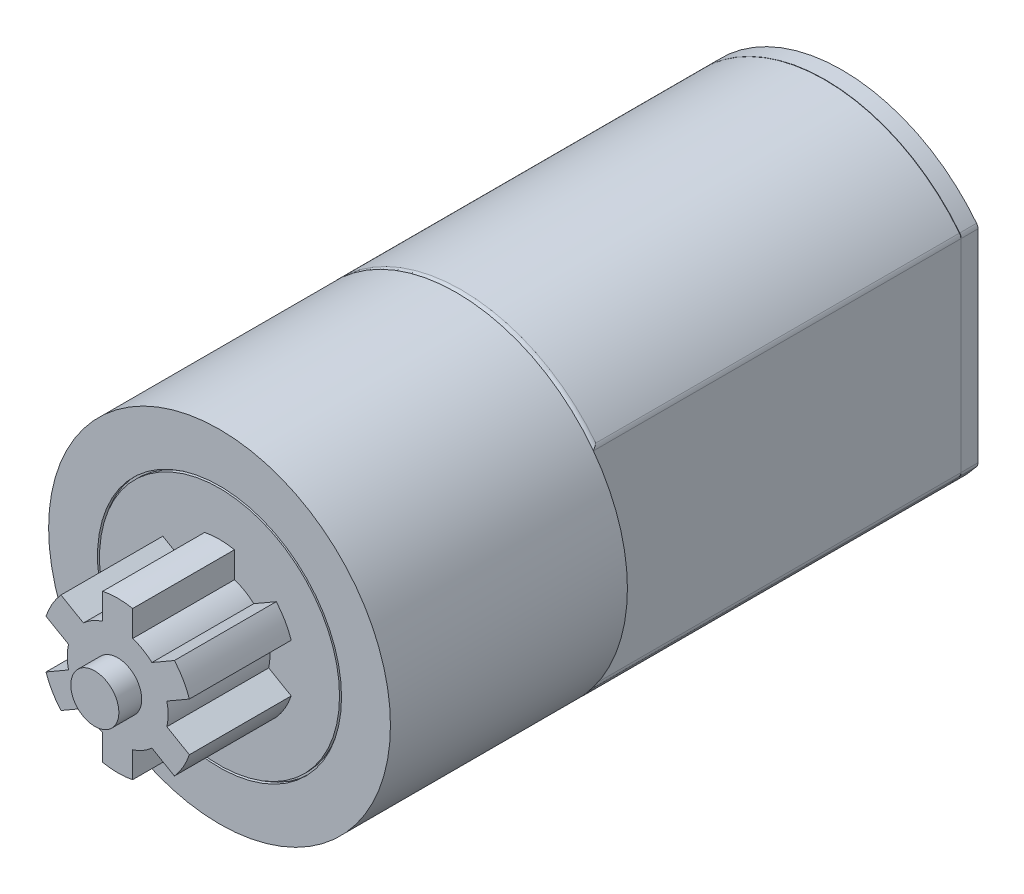
from build123d import *

# Parameters (mm, degrees)
SKETCH1_R           = 5.085
BOSS_EXTRUDE1_DEPTH = 23.23
SKETCH2_R           = 5.085
SKETCH2_R_2         = 2
CUT_EXTRUDE1_DEPTH  = 1
SKETCH4_R           = 0.8
CUT_EXTRUDE2_DEPTH  = 0.5
SKETCH5_W           = 3.99879876
SKETCH5_H           = 10.17
SKETCH5_W_2         = 3.491908776
CUT_EXTRUDE3_DEPTH  = 12.47
CUT_EXTRUDE4_START  = -3.71
SKETCH6_R           = 5.085
SKETCH6_R_2         = 2.25
CUT_EXTRUDE4_DEPTH  = 3.71
SKETCH7_R           = 3.63
SKETCH7_R_2         = 3.57
CUT_EXTRUDE5_DEPTH  = 0.1
CUT_EXTRUDE6_START  = -0.68
SKETCH8_R           = 2.25
SKETCH8_R_2         = 0.715
CUT_EXTRUDE6_DEPTH  = 0.68
CUT_EXTRUDE7_START  = -3.03
CUT_EXTRUDE7_DEPTH  = 3.03
SKETCH10_R          = 0.455
BOSS_EXTRUDE2_DEPTH = 0.68
CUT_EXTRUDE8_START  = 0.01
SKETCH11_R          = 5.085
SKETCH11_R_2        = 5.035
CUT_EXTRUDE8_DEPTH  = 0.01
FILLET3_R           = 0.2
CUT_EXTRUDE9_DEPTH  = 0.01


with BuildPart() as part:
    # Sketch1 → Boss-Extrude1 (new body)
    with BuildSketch(Plane.XY):
        Circle(SKETCH1_R)
    extrude(amount=BOSS_EXTRUDE1_DEPTH)

    # Sketch2 → Cut-Extrude1 (cut)
    with BuildSketch(Plane(origin=(0, 0, 0), x_dir=(-1, 0, 0), z_dir=(0, 0, -1))):
        Circle(SKETCH2_R)
        Circle(SKETCH2_R_2, mode=Mode.SUBTRACT)
    extrude(amount=-CUT_EXTRUDE1_DEPTH, mode=Mode.SUBTRACT)

    # Sketch4 → Cut-Extrude2 (cut)
    with BuildSketch(Plane(origin=(0, 0, 0), x_dir=(-1, 0, 0), z_dir=(0, 0, -1))):
        Circle(SKETCH4_R)
    extrude(amount=-CUT_EXTRUDE2_DEPTH, mode=Mode.SUBTRACT)

    # Sketch5 → Cut-Extrude3 (cut)
    with BuildSketch(Plane(origin=(0, 0, 0), x_dir=(-1, 0, 0), z_dir=(0, 0, -1))):
        with Locations((6.04439938, 0)):
            Rectangle(SKETCH5_W, SKETCH5_H)
        with Locations((-5.790954388, 0)):
            Rectangle(SKETCH5_W_2, SKETCH5_H)
    extrude(amount=-CUT_EXTRUDE3_DEPTH, mode=Mode.SUBTRACT)

    # Sketch6 → Cut-Extrude4 (cut)
    with BuildSketch(Plane.XY.offset(23.23).offset(CUT_EXTRUDE4_START)):
        with Locations(Location((0, 0, 0), (0, 0, 142.7003226))):
            Circle(SKETCH6_R)
        Circle(SKETCH6_R_2, mode=Mode.SUBTRACT)
    extrude(amount=CUT_EXTRUDE4_DEPTH, mode=Mode.SUBTRACT)

    # Sketch7 → Cut-Extrude5 (cut)
    with BuildSketch(Plane.XY.offset(19.52)):
        Circle(SKETCH7_R)
        Circle(SKETCH7_R_2, mode=Mode.SUBTRACT)
    extrude(amount=-CUT_EXTRUDE5_DEPTH, mode=Mode.SUBTRACT)

    # Sketch8 → Cut-Extrude6 (cut)
    with BuildSketch(Plane.XY.offset(23.23).offset(CUT_EXTRUDE6_START)):
        Circle(SKETCH8_R)
        Circle(SKETCH8_R_2, mode=Mode.SUBTRACT)
    extrude(amount=CUT_EXTRUDE6_DEPTH, mode=Mode.SUBTRACT)

    # Sketch9 → Cut-Extrude7 (cut)
    with BuildSketch(Plane.XY.offset(22.55).offset(CUT_EXTRUDE7_START)):
        with BuildLine():
            ThreePointArc((-1.018056831, 1.101617125), (-0.75, 1.299038106), (-0.445, 1.43247164))
            Line((-0.445, 1.43247164), (-0.445, 2.205555486))
            ThreePointArc((-0.445, 2.205555486), (-1.125, 1.948557159), (-1.68756708, 1.488159047))
            Line((-1.68756708, 1.488159047), (-1.018056831, 1.101617125))
        make_face()
        with BuildLine():
            Line((0.445, 2.205555486), (0.445, 1.43247164))
            ThreePointArc((0.445, 1.43247164), (0.75, 1.299038106), (1.018056831, 1.101617125))
            Line((1.018056831, 1.101617125), (1.68756708, 1.488159047))
            ThreePointArc((1.68756708, 1.488159047), (1.125, 1.948557159), (0.445, 2.205555486))
        make_face()
        with BuildLine():
            Line((2.13256708, 0.717396438), (1.463056831, 0.330854515))
            ThreePointArc((1.463056831, 0.330854515), (1.490735598, 0.16645533), (1.5, 0))
            ThreePointArc((1.5, 0), (1.490735598, -0.16645533), (1.463056831, -0.330854515))
            Line((1.463056831, -0.330854515), (2.13256708, -0.717396438))
            ThreePointArc((2.13256708, -0.717396438), (2.220447695, -0.363472193), (2.25, 0))
            ThreePointArc((2.25, 0), (2.220447695, 0.363472193), (2.13256708, 0.717396438))
        make_face()
        with BuildLine():
            Line((1.68756708, -1.488159047), (1.018056831, -1.101617125))
            ThreePointArc((1.018056831, -1.101617125), (0.75, -1.299038106), (0.445, -1.43247164))
            Line((0.445, -1.43247164), (0.445, -2.205555486))
            ThreePointArc((0.445, -2.205555486), (1.125, -1.948557159), (1.68756708, -1.488159047))
        make_face()
        with BuildLine():
            ThreePointArc((-0.445, -1.43247164), (-0.75, -1.299038106), (-1.018056831, -1.101617125))
            Line((-1.018056831, -1.101617125), (-1.68756708, -1.488159047))
            ThreePointArc((-1.68756708, -1.488159047), (-1.125, -1.948557159), (-0.445, -2.205555486))
            Line((-0.445, -2.205555486), (-0.445, -1.43247164))
        make_face()
        with BuildLine():
            ThreePointArc((-1.463056831, -0.330854515), (-1.5, 0), (-1.463056831, 0.330854515))
            Line((-1.463056831, 0.330854515), (-2.13256708, 0.717396438))
            ThreePointArc((-2.13256708, 0.717396438), (-2.25, 0), (-2.13256708, -0.717396438))
            Line((-2.13256708, -0.717396438), (-1.463056831, -0.330854515))
        make_face()
    extrude(amount=CUT_EXTRUDE7_DEPTH, mode=Mode.SUBTRACT)

    # Sketch10 → Boss-Extrude2 (add)
    with BuildSketch(Plane(origin=(0, 0, 1), x_dir=(-1, 0, 0), z_dir=(0, 0, -1))):
        with Locations((2.5, -3.145160742)):
            Circle(SKETCH10_R)
    extrude(amount=BOSS_EXTRUDE2_DEPTH)

    # Sketch11 → Cut-Extrude8 (cut)
    with BuildSketch(Plane(origin=(0, 0, 12.47), x_dir=(-1, 0, 0), z_dir=(0, 0, -1)).offset(CUT_EXTRUDE8_START)):
        Circle(SKETCH11_R)
        Circle(SKETCH11_R_2, mode=Mode.SUBTRACT)
    extrude(amount=-CUT_EXTRUDE8_DEPTH, mode=Mode.SUBTRACT)

    # Fillet3
    # the kernel refuses this fillet: 0.2 mm, written as the material it takes off along each edge
    with BuildSketch(Plane(origin=(0, 0, 12.46), x_dir=(-0.8331991700608187, 0.5529730038708609, 0), z_dir=(-0.5529730038708609, -0.8331991700608187, 0))) as fillet3_piece_1:
        with BuildLine():
            CenterArc((4.885, 0.132287566), FILLET3_R, 318.590377891, 41.409622109)
            Line((5.035, 0), (5.085, 0))
            Line((5.085, 0), (5.085, 0.132287566))
        make_face()
    fillet3_piece_1_solid = revolve(axis=Axis((0, 0, 12.46), (0, 0, -1)), revolution_arc=112.857572989, mode=Mode.PRIVATE)
    with BuildSketch(Plane(origin=(0, 0, 12.46), x_dir=(0.8331991700608224, -0.5529730038708549, 0), z_dir=(0.5529730038708549, 0.8331991700608224, 0))) as fillet3_piece_2:
        with BuildLine():
            CenterArc((4.885, 0.132287566), FILLET3_R, 318.590377891, 41.409622109)
            Line((5.085, 0.132287566), (5.085, 0))
            Line((5.085, 0), (5.035, 0))
        make_face()
    fillet3_piece_2_solid = revolve(axis=Axis((0, 0, 12.46), (0, 0, -1)), revolution_arc=112.857572989, mode=Mode.PRIVATE)
    with BuildSketch(Plane(origin=(-4.045, 3.08142824, 12.46), x_dir=(0.6114168469415571, 0.7913086877294123, 0), z_dir=(0, 0, -1))) as fillet3_piece_3:
        with BuildLine():
            CenterArc((0.068270891, 0.199995311), FILLET3_R, 232.307979121, 38.084364359)
            Line((-0.054012478, 0.041733573), (0, 0))
            ThreePointArc((0, 0), (0.034820209, -0.000119219), (0.069640417, 0))
        make_face()
    fillet3_piece_3_solid = extrude(amount=11.634101044, mode=Mode.PRIVATE)
    with BuildSketch(Plane(origin=(-4.045, -3.08142824, 12.46), x_dir=(0.6114168469415588, -0.7913086877294109, 0), z_dir=(0, 0, -1)), Plane(origin=(4.045, 3.08142824, 12.46), x_dir=(-0.6114168469415571, 0.7913086877294123, 0), z_dir=(0, 0, -1))) as fillet3_piece_4:
        with BuildLine():
            CenterArc((0.068270891, -0.199995311), FILLET3_R, 89.60765652, 38.084364359)
            Line((-0.054012478, -0.041733573), (0, 0))
            ThreePointArc((0, 0), (0.034820209, 0.000119219), (0.069640417, 0))
        make_face()
    fillet3_piece_4_solid = extrude(amount=11.634101044, mode=Mode.PRIVATE)
    with BuildSketch(Plane(origin=(4.045, -3.08142824, 12.46), x_dir=(0, 1, 0), z_dir=(0, 0, -1))) as fillet3_piece_5:
        with BuildLine():
            CenterArc((0.068257153, -0.2), FILLET3_R, 90, 38.084364359)
            ThreePointArc((-0.055107067, -0.042579324), (-0.027626426, -0.021195323), (0, 0))
            Line((0, 0), (0.068257153, 0))
        make_face()
    fillet3_piece_5_solid = extrude(amount=11.634101044, mode=Mode.PRIVATE)
    add([fillet3_piece_1_solid, fillet3_piece_2_solid, fillet3_piece_3_solid, fillet3_piece_4_solid, fillet3_piece_5_solid], mode=Mode.SUBTRACT)

    # Sketch15 → Cut-Extrude9 (cut)
    with BuildSketch(Plane(origin=(0, 0, 1.5), x_dir=(-1, 0, 0), z_dir=(0, 0, -1))):
        with BuildLine():
            Line((4.045, -3.013171087), (4.045, 3.013171087))
            ThreePointArc((4.045, 3.013171087), (4.034055726, 3.078423922), (4.002420676, 3.136535308))
            ThreePointArc((4.002420676, 3.136535308), (0, 5.085), (-4.002420676, 3.136535308))
            ThreePointArc((-4.002420676, 3.136535308), (-4.034055726, 3.078423922), (-4.045, 3.013171087))
            Line((-4.045, 3.013171087), (-4.045, -3.013171087))
            ThreePointArc((-4.045, -3.013171087), (-4.034055726, -3.078423922), (-4.002420676, -3.136535308))
            ThreePointArc((-4.002420676, -3.136535308), (0, -5.085), (4.002420676, -3.136535308))
            ThreePointArc((4.002420676, -3.136535308), (4.034055726, -3.078423922), (4.045, -3.013171087))
        make_face()
        with BuildLine():
            Line((-3.945, 3.120556841), (-3.945, -3.120556841))
            ThreePointArc((-3.945, -3.120556841), (0, -5.03), (3.945, -3.120556841))
            Line((3.945, -3.120556841), (3.945, 3.120556841))
            ThreePointArc((3.945, 3.120556841), (-0.000264914, 5.029999993), (-3.945, 3.120556841))
        make_face(mode=Mode.SUBTRACT)
    extrude(amount=-CUT_EXTRUDE9_DEPTH, mode=Mode.SUBTRACT)


solid = part.part
